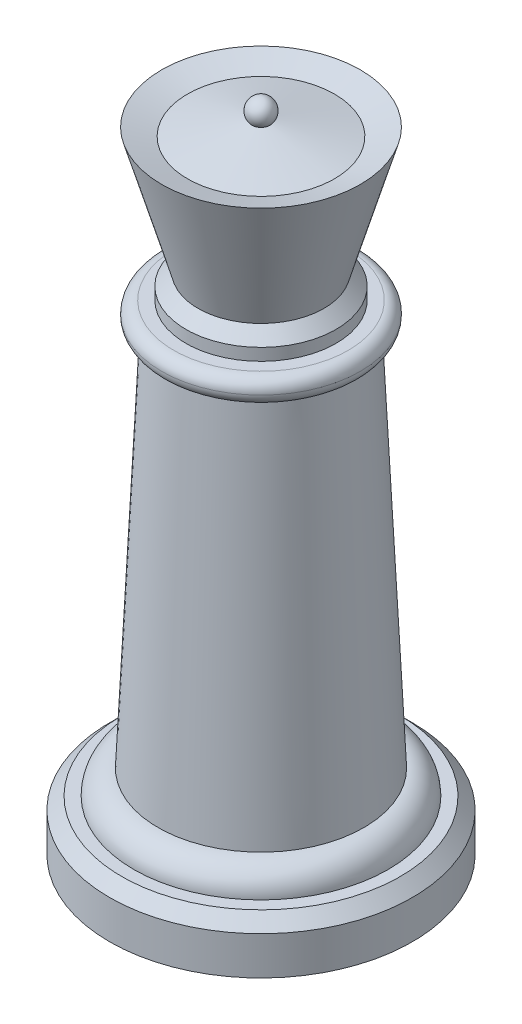
from build123d import *

# Parameters (mm, degrees)
CHAMFER1_SIZE = 0.762
FILLET1_R     = 1.524
FILLET2_R     = 0.762


with BuildPart() as part:
    # Sketch1 → Revolve1 (revolve)
    with BuildSketch(Plane.XY, mode=Mode.PRIVATE) as revolve1_sk:
        with BuildLine():
            Line((0, 0), (-9.525, 0))
            Line((-9.525, 0), (-9.525, 3.175))
            Line((-9.525, 3.175), (-8.001, 3.175))
            Line((-8.001, 3.175), (-8.001, 4.699))
            Line((-8.001, 4.699), (-6.477, 4.699))
            Line((-6.477, 4.699), (-5.3848, 28.6766))
            Line((-5.3848, 28.6766), (-6.2484, 28.6766))
            Line((-6.2484, 28.6766), (-6.2484, 30.2006))
            Line((-6.2484, 30.2006), (-4.7244, 30.2006))
            Line((-4.7244, 30.2006), (-4.7244, 31.7246))
            Line((-4.7244, 31.7246), (-3.9624, 31.7246))
            Line((-3.9624, 31.7246), (-6.2484, 39.624))
            Line((-6.2484, 39.624), (-4.6228, 39.116))
            Line((-4.6228, 39.116), (-0.569581457, 40.006817262))
            ThreePointArc((-0.569581457, 40.006817262), (-0.695109792, 40.825196055), (0, 41.275))
            Line((0, 41.275), (0, 0))
        make_face()
    revolve(revolve1_sk.sketch.rotate(Axis((0, 0, 0), (0, 1, 0)), 270), axis=Axis((0, 0, 0), (0, 1, 0)))

    # Chamfer1
    chamfer1_edges = [part.edges().sort_by_distance(p)[0] for p in [
        (0, 3.175, 9.525),
        (0, 31.7246, 4.7244),
    ]]
    chamfer(chamfer1_edges, length=CHAMFER1_SIZE - 0.0001)  # a hair under: the kernel refuses the full size

    # Fillet1
    fillet1_edges = [part.edges().sort_by_distance(p)[0] for p in [
        (0, 4.699, 8.001),
    ]]
    fillet(fillet1_edges, radius=FILLET1_R - 0.0001)  # a hair under: the kernel refuses the full size

    # Fillet2
    fillet2_edges = [part.edges().sort_by_distance(p)[0] for p in [
        (0, 28.6766, 6.2484),
        (0, 30.2006, 6.2484),
    ]]
    fillet(fillet2_edges, radius=FILLET2_R - 0.0001)  # a hair under: the kernel refuses the full size


solid = part.part
